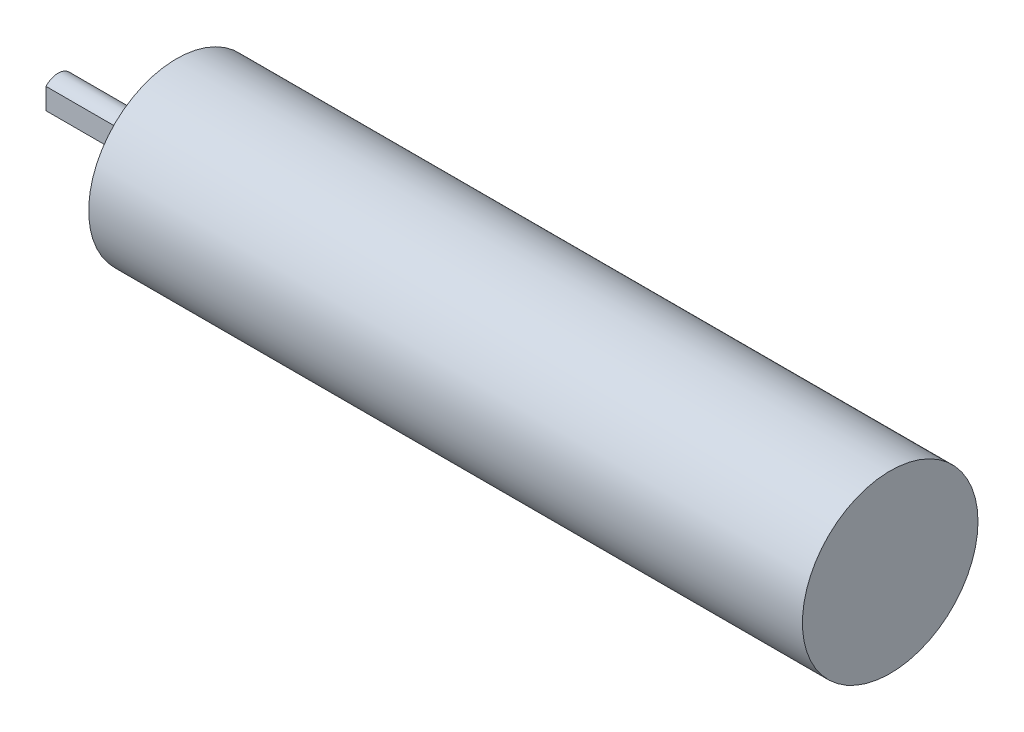
from build123d import *

# Parameters (mm, degrees)
SKETCH1_W           = 52.6
SKETCH1_H           = 11
SKETCH2_R           = 5
BOSS_EXTRUDE1_DEPTH = 1.35
SKETCH3_R           = 3.5
BOSS_EXTRUDE2_DEPTH = 1.8
SKETCH4_R           = 2
BOSS_EXTRUDE3_DEPTH = 11.7
CUT_EXTRUDE1_REACH  = 71.221
HOLE1_D             = 1.95
HOLE1_DEPTH         = 6.5
HOLE2_D             = 1.95
HOLE2_DEPTH         = 6.5
HOLE3_D             = 1.95
HOLE3_DEPTH         = 6.5
HOLE4_D             = 7
HOLE4_DEPTH         = 6.4
HOLE5_D             = 2.1
HOLE5_DEPTH         = 3
HOLE6_D             = 2.1
HOLE6_DEPTH         = 3
HOLE7_D             = 2.1
HOLE7_DEPTH         = 3
SKETCH25_R          = 11
BOSS_EXTRUDE4_DEPTH = 36.83


with BuildPart() as part:
    # Sketch1 → Revolve1 (revolve)
    with BuildSketch(Plane.XY):
        with Locations((26.3, 5.5)):
            Rectangle(SKETCH1_W, SKETCH1_H)
    revolve(axis=Axis((0, 0, 0), (1, 0, 0)))

    # Sketch2 → Boss-Extrude1 (add)
    with BuildSketch(Plane.ZY):
        Circle(SKETCH2_R)
    extrude(amount=BOSS_EXTRUDE1_DEPTH)

    # Sketch3 → Boss-Extrude2 (add)
    with BuildSketch(Plane.ZY.offset(1.35)):
        Circle(SKETCH3_R)
    extrude(amount=BOSS_EXTRUDE2_DEPTH)

    # Sketch4 → Boss-Extrude3 (add)
    with BuildSketch(Plane.ZY.offset(3.15)):
        Circle(SKETCH4_R)
    extrude(amount=BOSS_EXTRUDE3_DEPTH)

    # Cut-Extrude1: up to this plane
    cut_extrude1_end = Plane(origin=(-3.675, 0, 3.675), z_dir=(0.707106781186547, 0, -0.707106781186548))
    # Sketch6 → Cut-Extrude1 (cut, up to the surface)
    with BuildSketch(Plane.ZY.offset(14.85), mode=Mode.PRIVATE) as cut_extrude1_sk1:
        with BuildLine():
            Line((1.5, 1.322875656), (1.5, -1.322875656))
            ThreePointArc((1.5, -1.322875656), (2, 0), (1.5, 1.322875656))
        make_face()
    cut_extrude1_tool1 = split(extrude(cut_extrude1_sk1.sketch, amount=-CUT_EXTRUDE1_REACH, mode=Mode.PRIVATE), bisect_by=cut_extrude1_end, keep=Keep.BOTH, mode=Mode.PRIVATE)
    add(cut_extrude1_tool1.solids().sort_by_distance((-14.85, 0, 1.702311))[0], mode=Mode.SUBTRACT)

    # Hole1
    with Locations(Plane.ZY):
        with Locations((7, 0)):
            Hole(HOLE1_D / 2, depth=HOLE1_DEPTH)

    # Hole2
    with Locations(Plane.ZY):
        with Locations((-3.5, -6.062177826)):
            Hole(HOLE2_D / 2, depth=HOLE2_DEPTH)

    # Hole3
    with Locations(Plane.ZY):
        with Locations((-3.5, 6.062177826)):
            Hole(HOLE3_D / 2, depth=HOLE3_DEPTH)

    # Hole4
    with Locations(Plane(origin=(52.6, 0, 0), x_dir=(0, 0, -1), z_dir=(1, 0, 0))):
        with Locations((0, 0)):
            Hole(HOLE4_D / 2, depth=HOLE4_DEPTH)

    # Hole5
    with Locations(Plane(origin=(52.6, 0, 0), x_dir=(0, 0, -1), z_dir=(1, 0, 0))):
        with Locations((-8.5, 0)):
            Hole(HOLE5_D / 2, depth=HOLE5_DEPTH)

    # Hole6
    with Locations(Plane(origin=(52.6, 0, 0), x_dir=(0, 0, -1), z_dir=(1, 0, 0))):
        with Locations((4.25, -7.361215932)):
            Hole(HOLE6_D / 2, depth=HOLE6_DEPTH)

    # Hole7
    with Locations(Plane(origin=(52.6, 0, 0), x_dir=(0, 0, -1), z_dir=(1, 0, 0))):
        with Locations((4.25, 7.361215932)):
            Hole(HOLE7_D / 2, depth=HOLE7_DEPTH)

    # Sketch25 → Boss-Extrude4 (add)
    with BuildSketch(Plane(origin=(52.6, 0, 0), x_dir=(0, 0, -1), z_dir=(1, 0, 0))):
        Circle(SKETCH25_R)
    extrude(amount=BOSS_EXTRUDE4_DEPTH)


solid = part.part
